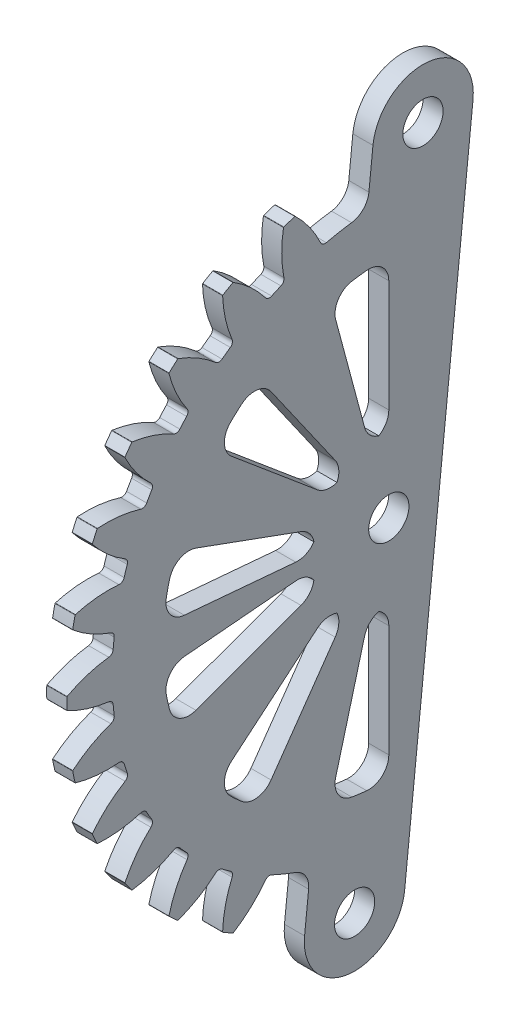
from build123d import *

# Parameters (mm, degrees)
BASPROSKE_W                = 2
BASPROSKE_H                = 32
TOOTHCUT_DEPTH             = 46.299006612
BREAKS_R                   = 0.04
ROOTFILLETS_R              = 0.501
TEETHCUTS_COUNT            = 30
TEETHCUTS_ANGLE            = 348
BREAKS_OF_TEETHCUTS_R      = 0.04
ROOTFILLETS_OF_TEETHCUTS_R = 0.501
BORSKE_R                   = 0.4
BORE_DEPTH                 = 50.0000508
CUT_EXTRUDE_1_DEPTH        = 10
CUT_EXTRUDE_3_DEPTH        = 46.214404006
EXTRUDE_1_DEPTH            = 2
SKETCH_5_R                 = 2
CUT_EXTRUDE_4_DEPTH        = 10
EXTRUDE_START              = -2
EXTRUDE_2_DEPTH            = 2
SKETCH_8_R                 = 2
CUT_EXTRUDE_6_DEPTH        = 2
CUT_EXTRUDE_7_DEPTH        = 10
FILLET_3_R                 = 2


with BuildPart() as part:
    # BasProSke → Base-Revolve (revolve)
    with BuildSketch(Plane(origin=(0, 0, 0), x_dir=(1, 0, 0), z_dir=(0, 1, 0)), mode=Mode.PRIVATE) as base_revolve_sk:
        with Locations((1, 16)):
            Rectangle(BASPROSKE_W, BASPROSKE_H)
    revolve(base_revolve_sk.sketch.rotate(Axis((-10, 0, 0), (1, 0, 0)), 180), axis=Axis((-10, 0, 0), (1, 0, 0)))

    # TooCutSke → ToothCut (cut, through all)
    with BuildSketch(Plane(origin=(0, 0, 0), x_dir=(0, 0, -1), z_dir=(1, 0, 0))):
        with BuildLine():
            ThreePointArc((0.918551563, 27.483654488), (0, 27.499), (-0.918551563, 27.483654488))
            ThreePointArc((-0.918551563, 27.483654488), (-1.617208176, 29.787801627), (-2.761784709, 31.906093311))
            ThreePointArc((-2.761784709, 31.906093311), (0, 32.0254), (2.761784709, 31.906093311))
            ThreePointArc((2.761784709, 31.906093311), (1.617208176, 29.787801627), (0.918551563, 27.483654488))
        make_face()
    toothcut = extrude(amount=TOOTHCUT_DEPTH, mode=Mode.SUBTRACT)

    # Breaks
    breaks_edges = [part.edges().sort_by_distance(p)[0] for p in [
        (1, 31.882005388, -2.745493119),
        (1, 31.882005388, 2.745493119),
    ]]
    fillet(breaks_edges, radius=BREAKS_R)

    # RootFillets
    rootfillets_edges = [part.edges().sort_by_distance(p)[0] for p in [
        (1, 27.483654488, -0.918551563),
        (1, 27.483654488, 0.918551563),
    ]]
    fillet(rootfillets_edges, radius=ROOTFILLETS_R)

    # TeethCuts: ToothCut ×30 about axis
    teethcuts_axis = Axis((-10, 0, 0), (1, 0, 0))
    for i in range(1, TEETHCUTS_COUNT):
        add(toothcut.rotate(teethcuts_axis, i * TEETHCUTS_ANGLE / (TEETHCUTS_COUNT - 1)), mode=Mode.SUBTRACT)

    # Breaks of TeethCuts
    breaks_of_teethcuts_edges = [part.edges().sort_by_distance(p)[0] for p in [
        (1, 31.756127193, 3.94314414),
        (1, 30.61448696, 9.314139154),
        (1, 30.242353857, 10.459447078),
        (1, 28.008968548, 15.475712613),
        (1, 27.406844539, 16.518621989),
        (1, 24.179323808, 20.960923171),
        (1, 23.373524601, 21.855853854),
        (1, 19.292926592, 25.530040805),
        (1, 18.31866948, 26.23788003),
        (1, 13.563335907, 28.983373149),
        (1, 12.4632006, 29.473184945),
        (1, 7.240962359, 31.169993008),
        (1, 6.063030049, 31.42037025),
        (1, 0.602124009, 31.994334603),
        (1, -0.602124009, 31.994334603),
        (1, -6.063030049, 31.42037025),
        (1, -7.240962359, 31.169993008),
        (1, -12.4632006, 29.473184945),
        (1, -13.563335907, 28.983373149),
        (1, -18.31866948, 26.23788003),
        (1, -19.292926592, 25.530040805),
        (1, -23.373524601, 21.855853854),
        (1, -24.179323808, 20.960923171),
        (1, -27.406844539, 16.518621989),
        (1, -28.008968548, 15.475712613),
        (1, -30.242353857, 10.459447078),
        (1, -30.61448696, 9.314139154),
        (1, -31.756127193, 3.94314414),
        (1, -31.882005388, 2.745493119),
        (1, -31.882005388, -2.745493119),
        (1, -31.756127193, -3.94314414),
        (1, -30.61448696, -9.314139154),
        (1, -30.242353857, -10.459447078),
        (1, -28.008968548, -15.475712613),
        (1, -27.406844539, -16.518621989),
        (1, -24.179323808, -20.960923171),
        (1, -23.373524601, -21.855853854),
        (1, -19.292926592, -25.530040805),
        (1, -18.31866948, -26.23788003),
        (1, -13.563335907, -28.983373149),
        (1, -12.4632006, -29.473184945),
        (1, -7.240962359, -31.169993008),
        (1, -6.063030049, -31.42037025),
        (1, -0.602124009, -31.994334603),
        (1, 0.602124009, -31.994334603),
        (1, 6.063030049, -31.42037025),
        (1, 7.240962359, -31.169993008),
        (1, 12.4632006, -29.473184945),
        (1, 13.563335907, -28.983373149),
        (1, 18.31866948, -26.23788003),
        (1, 19.292926592, -25.530040805),
        (1, 23.373524601, -21.855853854),
        (1, 24.179323808, -20.960923171),
        (1, 27.406844539, -16.518621989),
        (1, 28.008968548, -15.475712613),
        (1, 30.242353857, -10.459447078),
        (1, 30.61448696, -9.314139154),
        (1, 31.756127193, -3.94314414),
    ]]
    fillet(breaks_of_teethcuts_edges, radius=BREAKS_OF_TEETHCUTS_R)

    # RootFillets of TeethCuts
    rootfillets_of_teethcuts_edges = [part.edges().sort_by_distance(p)[0] for p in [
        (1, 27.074048306, 4.815694067),
        (1, 26.692093088, 6.612652082),
        (1, 25.481176297, 10.339470758),
        (1, 24.733959138, 12.017747974),
        (1, 22.774654611, 15.411362962),
        (1, 21.694832486, 16.897610612),
        (1, 19.072771234, 19.809704653),
        (1, 17.707537551, 21.038966583),
        (1, 14.537316233, 23.342267194),
        (1, 12.946338255, 24.260818757),
        (1, 9.366510754, 25.854660649),
        (1, 7.619321854, 26.422356736),
        (1, 3.786343811, 27.23708137),
        (1, 1.959304527, 27.429110937),
        (1, -1.959304527, 27.429110937),
        (1, -3.786343811, 27.23708137),
        (1, -7.619321854, 26.422356736),
        (1, -9.366510754, 25.854660649),
        (1, -12.946338255, 24.260818757),
        (1, -14.537316233, 23.342267194),
        (1, -17.707537551, 21.038966583),
        (1, -19.072771234, 19.809704653),
        (1, -21.694832486, 16.897610612),
        (1, -22.774654611, 15.411362962),
        (1, -24.733959138, 12.017747974),
        (1, -25.481176297, 10.339470758),
        (1, -26.692093088, 6.612652082),
        (1, -27.074048306, 4.815694067),
        (1, -27.483654488, 0.918551563),
        (1, -27.483654488, -0.918551563),
        (1, -27.074048306, -4.815694067),
        (1, -26.692093088, -6.612652082),
        (1, -25.481176297, -10.339470758),
        (1, -24.733959138, -12.017747974),
        (1, -22.774654611, -15.411362962),
        (1, -21.694832486, -16.897610612),
        (1, -19.072771234, -19.809704653),
        (1, -17.707537551, -21.038966583),
        (1, -14.537316233, -23.342267194),
        (1, -12.946338255, -24.260818757),
        (1, -9.366510754, -25.854660649),
        (1, -7.619321854, -26.422356736),
        (1, -3.786343811, -27.23708137),
        (1, -1.959304527, -27.429110937),
        (1, 1.959304527, -27.429110937),
        (1, 3.786343811, -27.23708137),
        (1, 7.619321854, -26.422356736),
        (1, 9.366510754, -25.854660649),
        (1, 12.946338255, -24.260818757),
        (1, 14.537316233, -23.342267194),
        (1, 17.707537551, -21.038966583),
        (1, 19.072771234, -19.809704653),
        (1, 21.694832486, -16.897610612),
        (1, 22.774654611, -15.411362962),
        (1, 24.733959138, -12.017747974),
        (1, 25.481176297, -10.339470758),
        (1, 26.692093088, -6.612652082),
        (1, 27.074048306, -4.815694067),
    ]]
    fillet(rootfillets_of_teethcuts_edges, radius=ROOTFILLETS_OF_TEETHCUTS_R)

    # BorSke → Bore (cut, symmetric)
    with BuildSketch(Plane(origin=(0, 0, 0), x_dir=(0, 0, -1), z_dir=(1, 0, 0))):
        with Locations(Location((0, 0, 0), (0, 0, 180))):
            Circle(BORSKE_R)
    extrude(amount=BORE_DEPTH, both=True, mode=Mode.SUBTRACT)

    # 草图1 → 切除-拉伸1 (cut)
    with BuildSketch(Plane(origin=(2, 0, 0), x_dir=(0, 0, -1), z_dir=(1, 0, 0))):
        Polygon((3.344910825, 31.824700652), (-3.583822414, -34.097792583), (46.01446086, -34.967079942), (40.123082726, 36.265037496), (5.109551316, 33.854928259), align=None)
    extrude(amount=-CUT_EXTRUDE_1_DEPTH, mode=Mode.SUBTRACT)

    # 草图2 → 切除-拉伸3 (cut, through all)
    with BuildSketch(Plane(origin=(2, 0, 0), x_dir=(0, 0, -1), z_dir=(1, 0, 0))):
        with BuildLine():
            Line((-4.955628743, 33.125956526), (-5.220898582, 26.998837364))
            ThreePointArc((-5.220898582, 26.998837364), (-2.621521938, 27.37375794), (0.001765851, 27.498999943))
            ThreePointArc((0.001765851, 27.498999943), (2.621461179, 27.373763758), (5.217311218, 26.999530823))
            Line((5.217311218, 26.999530823), (6.69784968, 31.664563246))
            Line((6.69784968, 31.664563246), (2.093141861, 33.125956526))
            Line((2.093141861, 33.125956526), (-4.955628743, 33.125956526))
        make_face()
        with BuildLine():
            Line((-14.141312973, -34.647678651), (-5.308765664, -36.679868774))
            Line((-5.308765664, -36.679868774), (1.234233654, -35.7970757))
            Line((1.234233654, -35.7970757), (0.000706271, -27.498999991))
            ThreePointArc((0.000706271, -27.498999991), (-2.874881922, -27.34830991), (-5.718946895, -26.897744281))
            ThreePointArc((-5.718946895, -26.897744281), (-8.257173885, -26.230022502), (-10.720183348, -25.323362138))
            Line((-10.720183348, -25.323362138), (-14.141312973, -34.647678651))
        make_face()
    extrude(amount=-CUT_EXTRUDE_3_DEPTH, mode=Mode.SUBTRACT)

    # 草图4 → 凸台-拉伸1 (add)
    with BuildSketch(Plane(origin=(2, 0, 0), x_dir=(0, 0, -1), z_dir=(1, 0, 0))):
        Polygon((2.874428211, 27.348357601), (-2.874428211, -27.348357601), (2.098181265, -27.870999917), (7.847037688, 26.825715284), align=None)
    extrude(amount=-EXTRUDE_1_DEPTH)

    # 草图5 → 切除-拉伸4 (cut)
    with BuildSketch(Plane(origin=(2, 0, 0), x_dir=(0, 0, -1), z_dir=(1, 0, 0))):
        Circle(SKETCH_5_R)
    extrude(amount=-CUT_EXTRUDE_4_DEPTH, mode=Mode.SUBTRACT)

    # 草图6 → 凸台-拉伸2 (add)
    with BuildSketch(Plane(origin=(2, 0, 0), x_dir=(0, 0, -1), z_dir=(1, 0, 0)).offset(EXTRUDE_START)):
        with BuildLine():
            Line((7.847037688, 26.825715284), (8.369680005, 31.798324761))
            ThreePointArc((8.369680005, 31.798324761), (3.919712844, 37.293576554), (-1.575538949, 32.843609394))
            Line((-1.575538949, 32.843609394), (-2.146095272, 27.415128599))
            ThreePointArc((-2.146095272, 27.415128599), (0.3656936, 27.496568317), (2.874428211, 27.348357601))
            Line((2.874428211, 27.348357601), (7.847037688, 26.825715284))
        make_face()
        with BuildLine():
            Line((-2.874428211, -27.348357601), (2.098181265, -27.870999917))
            Line((2.098181265, -27.870999917), (1.575538949, -32.843609394))
            ThreePointArc((1.575538949, -32.843609394), (-3.919712844, -37.293576554), (-8.369680005, -31.798324761))
            Line((-8.369680005, -31.798324761), (-7.799123682, -26.369843966))
            ThreePointArc((-7.799123682, -26.369843966), (-5.359155693, -26.971734302), (-2.874428211, -27.348357601))
        make_face()
    extrude(amount=EXTRUDE_2_DEPTH)

    # 草图8 → 切除-拉伸6 (cut)
    with BuildSketch(Plane(origin=(2, 0, 0), x_dir=(0, 0, -1), z_dir=(1, 0, 0))):
        with Locations((3.397175056, 32.321961599)):
            Circle(SKETCH_8_R)
        with Locations(Location((-3.397175056, -32.321961599, 0), (0, 0, 180))):
            Circle(SKETCH_8_R)
    extrude(amount=-CUT_EXTRUDE_6_DEPTH, mode=Mode.SUBTRACT)

    # 草图9 → 切除-拉伸7 (cut)
    with BuildSketch(Plane(origin=(2, 0, 0), x_dir=(0, 0, -1), z_dir=(1, 0, 0))):
        with BuildLine():
            Line((0, -7.5), (0, -22.5))
            ThreePointArc((0, -22.5), (-2.936839325, -22.307509381), (-5.823428515, -21.733331092))
            Line((-5.823428515, -21.733331092), (-1.941142838, -7.244443697))
            ThreePointArc((-1.941142838, -7.244443697), (-0.978946442, -7.43583646), (0, -7.5))
        make_face()
        with BuildLine():
            Line((-4.301823273, -6.143640332), (-12.905469818, -18.430920997))
            ThreePointArc((-12.905469818, -18.430920997), (-15.200779671, -16.588740078), (-17.23599997, -14.462721218))
            Line((-17.23599997, -14.462721218), (-5.745333323, -4.820907073))
            ThreePointArc((-5.745333323, -4.820907073), (-5.066926557, -5.529580026), (-4.301823273, -6.143640332))
        make_face()
        with BuildLine():
            Line((-7.047694656, -2.565151075), (-21.143083968, -7.695453225))
            ThreePointArc((-21.143083968, -7.695453225), (-21.96666016, -4.869891314), (-22.414380707, -1.961004212))
            Line((-22.414380707, -1.961004212), (-7.471460236, -0.653668071))
            ThreePointArc((-7.471460236, -0.653668071), (-7.322220053, -1.623297105), (-7.047694656, -2.565151075))
        make_face()
        with BuildLine():
            Line((-7.471460236, 0.653668071), (-22.414380707, 1.961004212))
            ThreePointArc((-22.414380707, 1.961004212), (-21.96666016, 4.869891314), (-21.143083968, 7.695453225))
            Line((-21.143083968, 7.695453225), (-7.047694656, 2.565151075))
            ThreePointArc((-7.047694656, 2.565151075), (-7.322220053, 1.623297105), (-7.471460236, 0.653668071))
        make_face()
        with BuildLine():
            Line((-5.745333323, 4.820907073), (-17.23599997, 14.462721218))
            ThreePointArc((-17.23599997, 14.462721218), (-15.200779671, 16.588740078), (-12.905469818, 18.430920997))
            Line((-12.905469818, 18.430920997), (-4.301823273, 6.143640332))
            ThreePointArc((-4.301823273, 6.143640332), (-5.066926557, 5.529580026), (-5.745333323, 4.820907073))
        make_face()
        with BuildLine():
            Line((-1.941142838, 7.244443697), (-5.823428515, 21.733331092))
            ThreePointArc((-5.823428515, 21.733331092), (-2.936839325, 22.307509381), (0, 22.5))
            Line((0, 22.5), (0, 7.5))
            ThreePointArc((0, 7.5), (-0.978946442, 7.43583646), (-1.941142838, 7.244443697))
        make_face()
    extrude(amount=-CUT_EXTRUDE_7_DEPTH, mode=Mode.SUBTRACT)

    # 圆角3
    # the kernel refuses this fillet: 2 mm, written as the material it adds along each edge
    with BuildSketch(Plane(origin=(2, -18.430920997, 12.905469818), x_dir=(0, 0.8191520442889912, -0.573576436351047), z_dir=(-1, 0, 0)), Plane(origin=(2, 21.733331092, 5.823428515), x_dir=(0, -0.9659258262890682, -0.2588190451025213), z_dir=(-1, 0, 0)), Plane(origin=(2, 14.462721218, 17.23599997), x_dir=(0, -0.642787609686537, -0.7660444431189799), z_dir=(-1, 0, 0)), Plane(origin=(2, -7.695453225, 21.143083968), x_dir=(0, 0.342020143325664, -0.9396926207859101), z_dir=(-1, 0, 0)), Plane(origin=(2, 1.961004212, 22.414380707), x_dir=(0, -0.08715574274765434, -0.9961946980917459), z_dir=(-1, 0, 0)), Plane(origin=(2, -22.5, 0), x_dir=(0, 1, 0), z_dir=(-1, 0, 0))) as fillet_3_piece_1:
        with BuildLine():
            CenterArc((2.097794237, -2), FILLET_3_R, 90, 95.598737816)
            ThreePointArc((0.107335138, -2.195121951), (0.026849805, -1.098872287), (0, 0))
            Line((0, 0), (2.097794237, 0))
        make_face()
    extrude(amount=2)
    with BuildSketch(Plane(origin=(2, -14.462721218, 17.23599997), x_dir=(0, -0.7337373482538188, -0.6794332224563752), z_dir=(-1, 0, 0)), Plane(origin=(2, 22.5, 0), x_dir=(0, -0.04883876831132492, 0.998806675343048), z_dir=(-1, 0, 0)), Plane(origin=(2, 18.430920997, 12.905469818), x_dir=(0, -0.6128983503496778, 0.7901617632729666), z_dir=(-1, 0, 0)), Plane(origin=(2, 7.695453225, 21.143083968), x_dir=(0, -0.9552751049492577, 0.29571857206503704), z_dir=(-1, 0, 0))) as fillet_3_piece_2:
        with BuildLine():
            CenterArc((2.100067037, -1.997613351), FILLET_3_R, 87.200631092, 95.598737816)
            Line((0.102453687, -2.095290887), (0, 0))
            ThreePointArc((0, 0), (1.098872287, 0.026849805), (2.197744574, 0))
        make_face()
    extrude(amount=2)
    with BuildSketch(Plane(origin=(2, -4.820907073, 5.745333323), x_dir=(0, -0.6936960644980823, -0.7202678460821866), z_dir=(-1, 0, 0)), Plane(origin=(2, 7.5, 0), x_dir=(0, -0.10585794590086184, 0.9943812625395), z_dir=(-1, 0, 0)), Plane(origin=(2, 6.143640332, 4.301823273), x_dir=(0, -0.657067413730586, 0.753831820642641), z_dir=(-1, 0, 0)), Plane(origin=(2, 2.565151075, 7.047694656), x_dir=(0, -0.9706182844853183, 0.2406244913195195), z_dir=(-1, 0, 0))) as fillet_3_piece_3:
        with BuildLine():
            CenterArc((1.79958508, 1.988762525), FILLET_3_R, 186.076598735, 77.846802531)
            Line((-0.189177445, 1.777046633), (0, 0))
            ThreePointArc((0, 0), (0.793934594, 0.042140531), (1.587869189, 0))
        make_face()
    extrude(amount=2)
    with BuildSketch(Plane(origin=(2, -6.143640332, 4.301823273), x_dir=(0, 0.6570674137305861, 0.753831820642641), z_dir=(-1, 0, 0)), Plane(origin=(2, 7.244443697, 1.941142838), x_dir=(0, 0.15511388497476963, -0.9878965951394073), z_dir=(-1, 0, 0)), Plane(origin=(2, 4.820907073, 5.745333323), x_dir=(0, 0.693696064498082, -0.7202678460821869), z_dir=(-1, 0, 0)), Plane(origin=(2, -7.5, 0), x_dir=(0, 0.10585794590086033, 0.9943812625395003), z_dir=(-1, 0, 0)), Plane(origin=(2, -2.565151075, 7.047694656), x_dir=(0, 0.9706182844853181, 0.24062449131952046), z_dir=(-1, 0, 0)), Plane(origin=(2, 0.653668071, 7.471460236), x_dir=(0, 0.9813712137228959, -0.1921211619683014), z_dir=(-1, 0, 0))) as fillet_3_piece_4:
        with BuildLine():
            CenterArc((1.79958508, -1.988762525), FILLET_3_R, 96.076598735, 77.846802531)
            Line((-0.189177445, -1.777046633), (0, 0))
            ThreePointArc((0, 0), (0.793934594, -0.042140531), (1.587869189, 0))
        make_face()
    extrude(amount=2)
    with BuildSketch(Plane(origin=(2, -7.244443697, 1.941142838), x_dir=(0, -0.9659258262890682, 0.2588190451025211), z_dir=(-1, 0, 0)), Plane(origin=(2, -0.653668071, 7.471460236), x_dir=(0, -0.08715574274765442, 0.9961946980917458), z_dir=(-1, 0, 0))) as fillet_3_piece_5:
        with BuildLine():
            CenterArc((1.787087811, -2), FILLET_3_R, 90, 77.846802531)
            ThreePointArc((-0.168088571, -1.578947368), (-0.042140531, -0.793934594), (0, 0))
            Line((0, 0), (1.787087811, 0))
        make_face()
    extrude(amount=2)
    with BuildSketch(Plane(origin=(2, -21.733331092, 5.823428515), x_dir=(0, 0.9659258262890682, -0.2588190451025213), z_dir=(-1, 0, 0)), Plane(origin=(2, -1.961004212, 22.414380707), x_dir=(0, 0.08715574274765445, -0.9961946980917459), z_dir=(-1, 0, 0))) as fillet_3_piece_6:
        with BuildLine():
            CenterArc((2.097794237, 2), FILLET_3_R, 174.401262184, 95.598737816)
            ThreePointArc((0.107335138, 2.195121951), (0.026849805, 1.098872287), (0, 0))
            Line((0, 0), (2.097794237, 0))
        make_face()
    extrude(amount=2)
    with BuildSketch(Plane(origin=(0, 27.415128599, 2.146095272), x_dir=(0, -0.10629080062659839, 0.994335087232748), z_dir=(1, 0, 0))) as fillet_3_piece_7:
        with BuildLine():
            CenterArc((1.616808387, -1.999195205), FILLET_3_R, 91.625473252, 76.27298655)
            Line((-0.338746816, -1.579905511), (0, 0))
            ThreePointArc((0, 0), (0.780038139, -0.011065529), (1.560076278, 0))
        make_face()
    extrude(amount=2)
    with BuildSketch(Plane(origin=(0, -26.369843966, 7.799123682), x_dir=(0, -0.994521895368274, 0.10452846326764759), z_dir=(1, 0, 0))) as fillet_3_piece_8:
        with BuildLine():
            CenterArc((1.615812745, -2), FILLET_3_R, 90, 76.27298655)
            ThreePointArc((-0.327061953, -1.525407641), (-0.15271135, -0.765023652), (0, 0))
            Line((0, 0), (1.615812745, 0))
        make_face()
    extrude(amount=2)


solid = part.part
